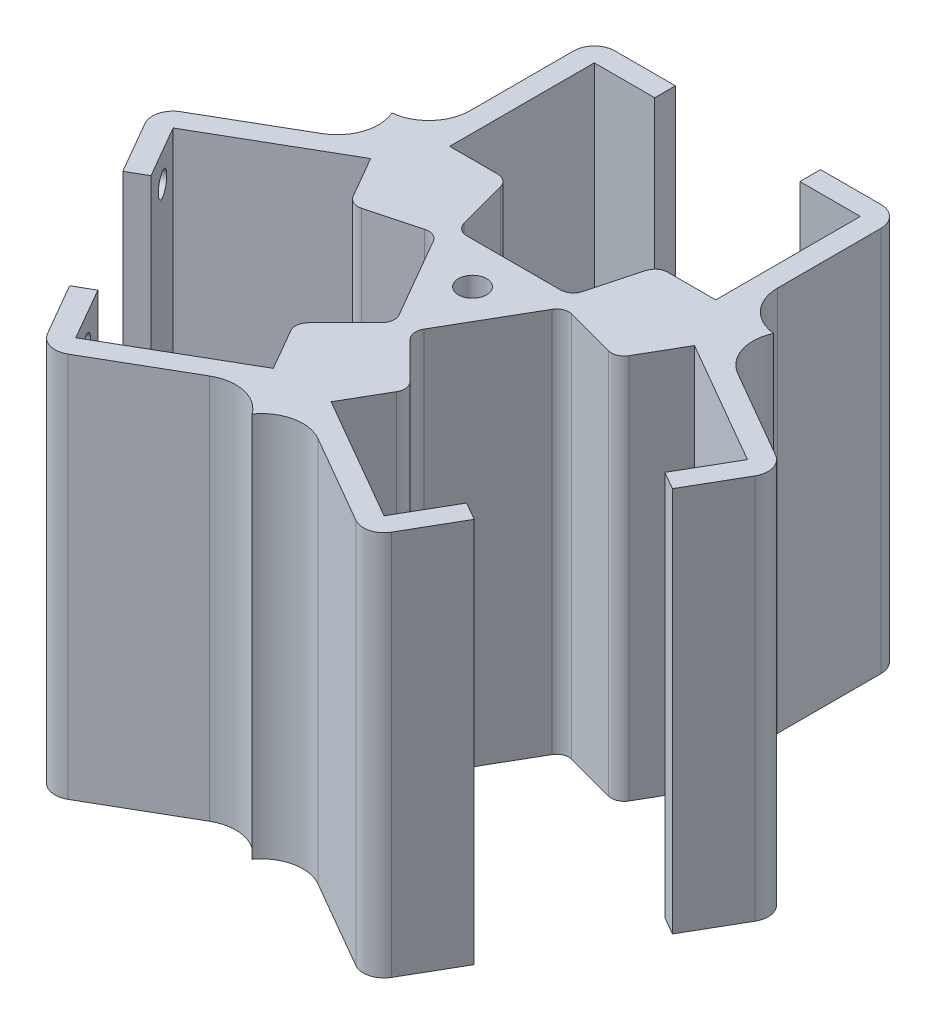
from build123d import *

# Parameters (mm, degrees)
SALIENTE_EXTRUIR1_DEPTH = 88.9
CROQUIS4_R              = 3.25
CORTAR_EXTRUIR1_DEPTH   = 112.44204772
REDONDEO6_R             = 3
REDONDEO7_R             = 3
ESCALA2_SCALE           = 1.05
SALIENTE_EXTRUIR2_DEPTH = 93.345
REDONDEO8_R             = 10
REDONDEO9_R             = 10
REDONDEO12_R            = 10
REDONDEO13_R            = 10
REDONDEO14_R            = 10
REDONDEO16_R            = 10
REDONDEO17_R            = 3
CROQUIS20_R             = 2.78
CORTAR_EXTRUIR7_DEPTH   = 10
ESCALA3_SCALE           = 0.9


with BuildPart() as part:
    # Croquis1 → Saliente-Extruir1 (new body)
    with BuildSketch(Plane(origin=(0, 0, 0), x_dir=(1, 0, 0), z_dir=(0, 1, 0))):
        Polygon((1.696358741, -16.064461222), (13.335, -27.703102481), (0, -50.8), (-13.335, -27.703102481), (-1.696358741, -16.064461222), (-14.760410887, 6.563140847), (-30.659090512, 2.303102481), (-43.994090512, 25.4), (-17.324090512, 25.4), (-13.064052146, 9.501320374), (13.064052146, 9.501320374), (17.324090512, 25.4), (43.994090512, 25.4), (30.659090512, 2.303102481), (14.760410887, 6.563140847), align=None)
    extrude(amount=SALIENTE_EXTRUIR1_DEPTH)

    # Croquis4 → Cortar-Extruir1 (cut, through all)
    with BuildSketch(Plane(origin=(0, 88.9, 0), x_dir=(1, 0, 0), z_dir=(0, 1, 0))):
        with Locations(Location((0, 0, 0), (0, 0, 270))):
            Circle(CROQUIS4_R)
    extrude(amount=-CORTAR_EXTRUIR1_DEPTH, mode=Mode.SUBTRACT)

    # Redondeo6
    redondeo6_edges = [part.edges().sort_by_distance(p)[0] for p in [
        (-1.696358741, 44.45, 16.064461222),
        (-14.760410887, 44.45, -6.563140847),
        (-13.064052146, 44.45, -9.501320374),
        (13.064052146, 44.45, -9.501320374),
        (1.696358741, 44.45, 16.064461222),
    ]]
    fillet(redondeo6_edges, radius=REDONDEO6_R)

    # Redondeo7
    redondeo7_edges = [part.edges().sort_by_distance(p)[0] for p in [
        (-13.335, 44.45, 27.703102481),
        (-30.659090512, 44.45, -2.303102481),
        (-17.324090512, 44.45, -25.4),
        (17.324090512, 44.45, -25.4),
        (30.659090512, 44.45, -2.303102481),
        (13.335, 44.45, 27.703102481),
    ]]
    fillet(redondeo7_edges, radius=REDONDEO7_R)


with BuildPart() as part_1:
    # Escala2: scaled about (-0.00814633, 44.45, 0.003262785)
    add(part.part.scale(ESCALA2_SCALE).moved(Location((0.000407317, -2.2225, -0.000163139))))

    # Croquis9 → Saliente-Extruir2 (add, through all)
    with BuildSketch(Plane(origin=(0, 91.1225, 0), x_dir=(1, 0, 0), z_dir=(0, 1, 0))):
        with BuildLine():
            Line((-37.193388788, 26.670163139), (-37.193388788, 61.670162712))
            ThreePointArc((-37.193388788, 61.670162712), (-35.728922694, 65.205696618), (-32.193388788, 66.670162712))
            Line((-32.193388788, 66.670162712), (-17.564301381, 66.670162712))
            Line((-17.564301381, 66.670162712), (-17.564301381, 61.670162712))
            Line((-17.564301381, 61.670162712), (-32.193388788, 61.670162712))
            Line((-32.193388788, 61.670162712), (-32.193388788, 26.670163139))
            Line((-32.193388788, 26.670163139), (-37.193388788, 26.670163139))
        make_face()
        with BuildLine():
            Line((-69.504104547, -2.954490104), (-39.193215784, 14.545509683))
            Line((-39.193215784, 14.545509683), (-41.693215784, 18.875636702))
            Line((-41.693215784, 18.875636702), (-72.004104547, 1.375636915))
            ThreePointArc((-72.004104547, 1.375636915), (-74.333733678, -1.660394878), (-73.834231566, -5.454490104))
            Line((-73.834231566, -5.454490104), (-66.519687862, -18.123651433))
            Line((-66.519687862, -18.123651433), (-62.189560843, -15.623651433))
            Line((-62.189560843, -15.623651433), (-69.504104547, -2.954490104))
        make_face()
        with BuildLine():
            Line((32.193388788, 61.670162712), (32.193388788, 26.670163139))
            Line((32.193388788, 26.670163139), (37.193388788, 26.670163139))
            Line((37.193388788, 26.670163139), (37.193388788, 61.670162712))
            ThreePointArc((37.193388788, 61.670162712), (35.728922694, 65.205696618), (32.193388788, 66.670162712))
            Line((32.193388788, 66.670162712), (17.564301381, 66.670162712))
            Line((17.564301381, 66.670162712), (17.564301381, 61.670162712))
            Line((17.564301381, 61.670162712), (32.193388788, 61.670162712))
        make_face()
        with BuildLine():
            Line((39.193733196, 14.545210955), (41.693733196, 18.875337974))
            Line((41.693733196, 18.875337974), (72.004621958, 1.375338188))
            ThreePointArc((72.004621958, 1.375338188), (74.33425109, -1.660693606), (73.834748977, -5.454788831))
            Line((73.834748977, -5.454788831), (66.520205273, -18.123950161))
            Line((66.520205273, -18.123950161), (62.190078254, -15.623950161))
            Line((62.190078254, -15.623950161), (69.504621958, -2.954788831))
            Line((69.504621958, -2.954788831), (39.193733196, 14.545210955))
        make_face()
        with BuildLine():
            Line((37.31123317, -58.715373881), (7.000344407, -41.215374094))
            Line((7.000344407, -41.215374094), (4.500344407, -45.545501113))
            Line((4.500344407, -45.545501113), (34.81123317, -63.0455009))
            ThreePointArc((34.81123317, -63.0455009), (38.605328395, -63.545003012), (41.641360189, -61.215373881))
            Line((41.641360189, -61.215373881), (48.955903893, -48.546212551))
            Line((48.955903893, -48.546212551), (44.625776874, -46.046212551))
            Line((44.625776874, -46.046212551), (37.31123317, -58.715373881))
        make_face()
        with BuildLine():
            Line((-6.999826996, -41.215075367), (-4.499826996, -45.545202386))
            Line((-4.499826996, -45.545202386), (-34.810715758, -63.045202172))
            ThreePointArc((-34.810715758, -63.045202172), (-38.604810984, -63.544704284), (-41.640842777, -61.215075153))
            Line((-41.640842777, -61.215075153), (-48.955386481, -48.545913824))
            Line((-48.955386481, -48.545913824), (-44.625259462, -46.045913824))
            Line((-44.625259462, -46.045913824), (-37.310715758, -58.715075153))
            Line((-37.310715758, -58.715075153), (-6.999826996, -41.215075367))
        make_face()
    extrude(amount=-SALIENTE_EXTRUIR2_DEPTH)

    # Redondeo8
    # the kernel refuses this fillet: 10 mm, written as the material it adds along each edge
    with BuildSketch(Plane(origin=(-37.193388788, 91.1225, -26.670163139), x_dir=(-1, 0, 0), z_dir=(0, -1, 0))) as redondeo8_piece_1_section:
        with BuildLine():
            CenterArc((10, 9.949874264), REDONDEO8_R, 180, 84.260823378)
            Line((0, 9.949874264), (-0.2, 9.949874264))
            Line((-0.2, 9.949874264), (-0.2, 0))
            Line((-0.2, 0), (0, -0.2))
            ThreePointArc((0, -0.2), (4.499999466, -0.2), (8.979998912, -0.198997485))
            Line((8.979998912, -0.198997485), (8.999998933, 0))
        make_face()
    redondeo8_piece_1 = extrude(amount=93.345, mode=Mode.PRIVATE)
    redondeo8_piece_1 = split(redondeo8_piece_1, bisect_by=Plane(origin=(-45.471806186, 44.45, -25.420347259), z_dir=(0.8660254037844427, 0, -0.49999999999999306)), keep=Keep.TOP, mode=Mode.PRIVATE)
    add(redondeo8_piece_1)

    # Redondeo9
    # the kernel refuses this fillet: 10 mm, written as the material it adds along each edge
    with BuildSketch(Plane(origin=(37.193388788, 91.1225, -26.670163139), x_dir=(0, 0, -1), z_dir=(0, -1, 0))) as redondeo9_piece_1_section:
        with BuildLine():
            CenterArc((9.949956104, 10), REDONDEO9_R, 185.734485624, 84.265514376)
            Line((0, 9.000813566), (-0.198999122, 8.980829837))
            ThreePointArc((-0.198999122, 8.980829837), (-0.2, 4.500406783), (-0.2, 0))
            Line((-0.2, 0), (0, -0.2))
            Line((0, -0.2), (9.949956104, -0.2))
            Line((9.949956104, -0.2), (9.949956104, 0))
        make_face()
    redondeo9_piece_1 = extrude(amount=93.345, mode=Mode.PRIVATE)
    redondeo9_piece_1 = split(redondeo9_piece_1, bisect_by=Plane(origin=(45.472441412, 44.45, -25.420036516), z_dir=(-0.8660254037844312, 0, -0.5000000000000131)), keep=Keep.TOP, mode=Mode.PRIVATE)
    add(redondeo9_piece_1)

    # Redondeo12
    # the kernel refuses this fillet: 10 mm, written as the material it adds along each edge
    with BuildSketch(Plane(origin=(4.500437971, 91.1225, 45.545555132), x_dir=(0.8660254037844384, 0, 0.5000000000000003), z_dir=(0, -1, 0))) as redondeo12_piece_1_section:
        with BuildLine():
            CenterArc((9.949880533, 10), REDONDEO12_R, 185.738817437, 84.261182563)
            Line((0, 9.000061308), (-0.198997611, 8.980062535))
            ThreePointArc((-0.198997611, 8.980062535), (-0.2, 4.500030654), (-0.2, 0))
            Line((-0.2, 0), (0, -0.2))
            Line((0, -0.2), (9.949880533, -0.2))
            Line((9.949880533, -0.2), (9.949880533, 0))
        make_face()
    redondeo12_piece_1 = extrude(amount=93.345, mode=Mode.PRIVATE)
    redondeo12_piece_1 = split(redondeo12_piece_1, bisect_by=Plane(origin=(-0.721187955, 44.45, 52.089997188), z_dir=(0.8660254037844385, 0, -0.5000000000000004)), keep=Keep.TOP, mode=Mode.PRIVATE)
    add(redondeo12_piece_1)

    # Redondeo13
    # the kernel refuses this fillet: 10 mm, written as the material it adds along each edge
    with BuildSketch(Plane(origin=(41.693826759, 91.1225, -18.875283955), x_dir=(0.500000000000013, 0, -0.8660254037844312), z_dir=(0, -1, 0))) as redondeo13_piece_1_section:
        with BuildLine():
            CenterArc((10, 9.94994984), REDONDEO13_R, 180, 84.265155193)
            Line((0, 9.94994984), (-0.2, 9.94994984))
            Line((-0.2, 9.94994984), (-0.2, 0))
            Line((-0.2, 0), (0, -0.2))
            ThreePointArc((0, -0.2), (4.500375595, -0.2), (8.980766214, -0.198998997))
            Line((8.980766214, -0.198998997), (9.00075119, 0))
        make_face()
    redondeo13_piece_1 = extrude(amount=93.345, mode=Mode.PRIVATE)
    redondeo13_piece_1 = redondeo13_piece_1 - Plane(origin=(47.193388788, 44.45, -36.620119243), x_dir=(0, 0, -1), z_dir=(0, 1, 0)) * Cylinder(10, 227, mode=Mode.PRIVATE)
    add(redondeo13_piece_1)

    # Redondeo14
    # the kernel refuses this fillet: 10 mm, written as the material it adds along each edge
    with BuildSketch(Plane(origin=(-4.499826996, 91.1225, 45.545202386), x_dir=(0.4999999999984365, 0, 0.8660254037853413), z_dir=(0, -1, 0))) as redondeo14_piece_1_section:
        with BuildLine():
            CenterArc((10, 9.949921458), REDONDEO14_R, 180, 84.263528066)
            Line((0, 9.949921459), (-0.2, 9.949921459))
            Line((-0.2, 9.949921459), (-0.2, 0))
            Line((-0.2, 0), (0, -0.2))
            ThreePointArc((0, -0.2), (4.500234312, -0.2), (8.980477997, -0.198998429))
            Line((8.980477997, -0.198998429), (9.000468625, 0))
        make_face()
    redondeo14_piece_1 = extrude(amount=93.345, mode=Mode.PRIVATE)
    redondeo14_piece_1 = redondeo14_piece_1 - Plane(origin=(8.117287277, 44.45, 59.180749436), x_dir=(0.866025403784329, 0, 0.50000000000019), z_dir=(0, 1, 0)) * Cylinder(10, 227, mode=Mode.PRIVATE)
    add(redondeo14_piece_1)

    # Redondeo16
    # the kernel refuses this fillet: 10 mm, written as the material it adds along each edge
    with BuildSketch(Plane(origin=(-41.693215784, 91.1225, -18.875636702), x_dir=(-0.8660254037844388, 0, 0.4999999999999999), z_dir=(0, -1, 0))) as redondeo16_piece_1_section:
        with BuildLine():
            CenterArc((9.949908926, 10), REDONDEO16_R, 185.737190303, 84.262809697)
            Line((0, 9.000343874), (-0.198998178, 8.980350751))
            ThreePointArc((-0.198998178, 8.980350751), (-0.2, 4.500171937), (-0.2, 0))
            Line((-0.2, 0), (0, -0.2))
            Line((0, -0.2), (9.949908926, -0.2))
            Line((9.949908926, -0.2), (9.949908926, 0))
        make_face()
    redondeo16_piece_1 = extrude(amount=93.345, mode=Mode.PRIVATE)
    redondeo16_piece_1 = redondeo16_piece_1 - Plane(origin=(-47.193388788, 44.45, -36.620037403), x_dir=(-1, 0, 0), z_dir=(0, 1, 0)) * Cylinder(10, 227, mode=Mode.PRIVATE)
    add(redondeo16_piece_1)

    # Redondeo17
    redondeo17_edges = [part_1.edges().sort_by_distance(p)[0] for p in [
        (15.498838747, 44.45, -6.891461029),
    ]]
    fillet(redondeo17_edges, radius=REDONDEO17_R)

    # Croquis20 → Cortar-Extruir7 (cut)
    with BuildSketch(Plane(origin=(-57.737537171, 0, 33.334782628), x_dir=(0.5000000000000017, 0, 0.8660254037844378), z_dir=(-0.8660254037844377, 0, 0.5000000000000016))):
        with Locations((25.193388788, 4.7775)):
            Circle(CROQUIS20_R)
        with Locations((25.193388788, 84.1225)):
            Circle(CROQUIS20_R)
        with Locations((-25.193388788, 84.1225)):
            Circle(CROQUIS20_R)
        with Locations((-25.193388788, 4.7775)):
            Circle(CROQUIS20_R)
    extrude(amount=-CORTAR_EXTRUIR7_DEPTH, mode=Mode.SUBTRACT)


with BuildPart() as part_2:
    # Escala3: scaled about (0.076174525, 44.45, -0.044030198)
    add(part_1.part.scale(ESCALA3_SCALE).moved(Location((0.007617452, 4.445, -0.00440302))))


solid = part_2.part
